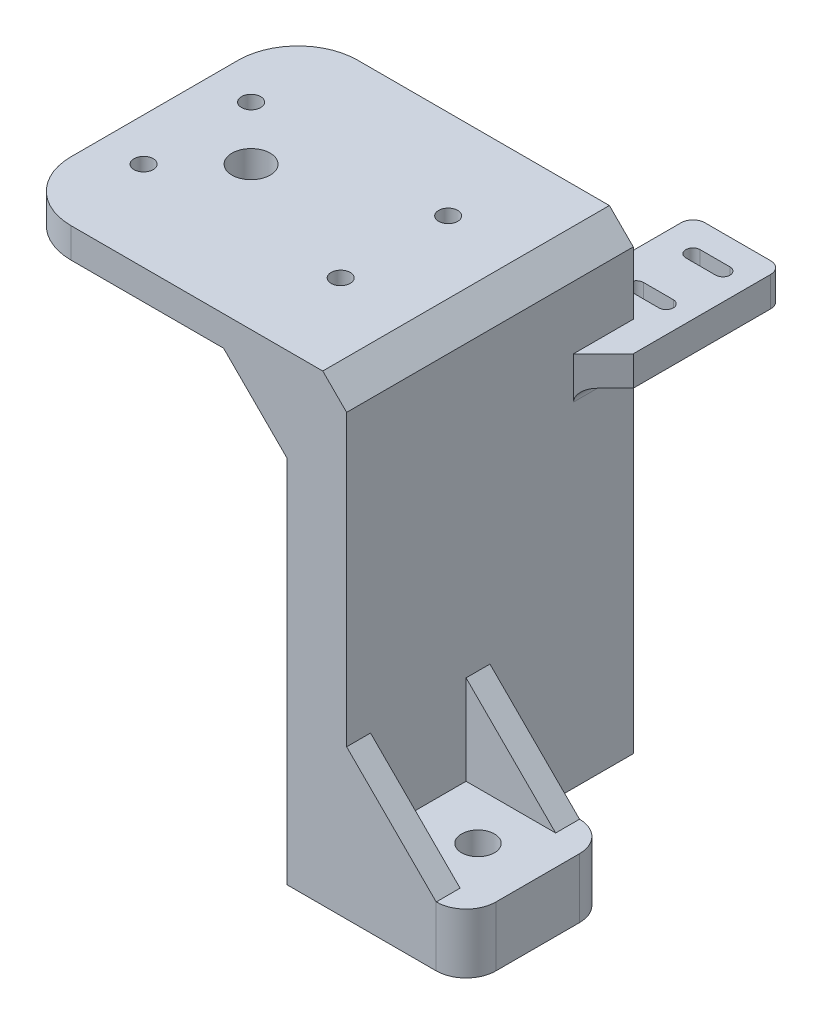
from build123d import *

# Parameters (mm, degrees)
SKETCH1_W                 = 56.15
SKETCH1_H                 = 48
BOSS_EXTRUDE1_DEPTH       = 5
SKETCH2_W                 = 10
SKETCH2_H                 = 48
BOSS_EXTRUDE2_DEPTH       = 72.5
SKETCH3_W                 = 24
SKETCH3_H                 = 10
BOSS_EXTRUDE3_DEPTH       = 20
SKETCH20_W                = 24
SKETCH20_H                = 10
BOSS_EXTRUDE5_DEPTH       = 20
FILLET1_R                 = 10
F_1_0MM_DOWEL_HOLE1_D     = 5.5
F_1_0MM_DOWEL_HOLE1_DEPTH = 10
FILLET2_R                 = 5
RIB1_REACH                = 103.39
SKETCH19_WALL_W           = 225.992615606
SKETCH19_WALL_H           = 4
M3_CLEARANCE_HOLE1_D      = 3.2
M3_CLEARANCE_HOLE1_DEPTH  = 5
M6_CLEARANCE_HOLE1_D      = 6.4
CHAMFER2_SIZE             = 4
SKETCH14_W                = 15
SKETCH14_H                = 5
BOSS_EXTRUDE4_DEPTH       = 20
CHAMFER3_SIZE             = 10
FILLET3_R                 = 2
M2_START                  = -14.5
M2_CLEARANCE_SLOT2_DEPTH  = 5
RIB5_REACH                = 103.39
SKETCH21_WALL_W           = 225.992615606
SKETCH21_WALL_H           = 4
BOSS_EXTRUDE6_DEPTH       = 4


# Read off the part's stored shape, not the designer's step: M2 Clearance Slot2
with BuildPart() as part:
    # Sketch1 → Boss-Extrude1 (new body)
    with BuildSketch(Plane(origin=(0, 0, 0), x_dir=(1, 0, 0), z_dir=(0, 1, 0))):
        with Locations((4.075, 0)):
            Rectangle(SKETCH1_W, SKETCH1_H)
    extrude(amount=BOSS_EXTRUDE1_DEPTH)

    # Sketch2 → Boss-Extrude2 (add)
    with BuildSketch(Plane.XZ):
        with Locations((27.15, 0)):
            Rectangle(SKETCH2_W, SKETCH2_H)
    extrude(amount=BOSS_EXTRUDE2_DEPTH)

    # Sketch3 → Boss-Extrude3 (add)
    with BuildSketch(Plane(origin=(32.15, 0, 0), x_dir=(0, 0, -1), z_dir=(1, 0, 0))):
        with Locations((-12, -67.5)):
            Rectangle(SKETCH3_W, SKETCH3_H)
    extrude(amount=BOSS_EXTRUDE3_DEPTH)

    # Sketch20 → Boss-Extrude5 (add)
    with BuildSketch(Plane.ZY.offset(-22.15)):
        with Locations((-12, -67.5)):
            Rectangle(SKETCH20_W, SKETCH20_H)
    extrude(amount=BOSS_EXTRUDE5_DEPTH)

    # Fillet1
    fillet1_edges = [part.edges().sort_by_distance(p)[0] for p in [
        (-24, 2.5, -24),
        (-24, 2.5, 24),
    ]]
    fillet(fillet1_edges, radius=FILLET1_R)

    # Ø1.0mm Dowel Hole1
    with Locations(Plane(origin=(0, -62.5, 0), x_dir=(1, 0, 0), z_dir=(0, 1, 0))):
        with Locations((42.15, -12), (12.15, 12)):
            Hole(F_1_0MM_DOWEL_HOLE1_D / 2, depth=F_1_0MM_DOWEL_HOLE1_DEPTH)

    # Fillet2
    fillet2_edges = [part.edges().sort_by_distance(p)[0] for p in [
        (52.15, -67.5, 24),
        (52.15, -67.5, 0),
        (2.15, -67.5, -24),
        (2.15, -67.5, 0),
    ]]
    fillet(fillet2_edges, radius=FILLET2_R)

    # Sketch19 wall → Rib1 (add, up to next)
    with BuildSketch(Plane(origin=(39.65, -55, 24), x_dir=(0.707106781187, -0.707106781187, 0), z_dir=(0.707106781187, 0.707106781187, 0)), mode=Mode.PRIVATE) as rib1_sk1:
        with Locations((0, 2)):
            Rectangle(SKETCH19_WALL_W, SKETCH19_WALL_H)
    rib1_tool1 = extrude(rib1_sk1.sketch, amount=-RIB1_REACH, mode=Mode.PRIVATE) - part.part
    rib1 = rib1_tool1.solids().sort_by_distance((39.65, -55, 24))[0]
    add(rib1)

    # M3 Clearance Hole1
    with Locations(Plane(origin=(0, 5, 0), x_dir=(1, 0, 0), z_dir=(0, 1, 0))):
        with Locations((-16.85, -9), (-16.85, 9), (16.15, 9), (16.15, -9)):
            Hole(M3_CLEARANCE_HOLE1_D / 2, depth=M3_CLEARANCE_HOLE1_DEPTH)

    # M6 Clearance Hole1 (through all)
    with Locations(Plane(origin=(0, 5, 0), x_dir=(1, 0, 0), z_dir=(0, 1, 0))):
        with Locations((-7.85, 0)):
            Hole(M6_CLEARANCE_HOLE1_D / 2)

    # Chamfer2
    chamfer2_edges = [part.edges().sort_by_distance(p)[0] for p in [
        (32.15, 5, 0),
    ]]
    chamfer(chamfer2_edges, length=CHAMFER2_SIZE)

    # Sketch14 → Boss-Extrude4 (add)
    with BuildSketch(Plane(origin=(0, 0, -24), x_dir=(-1, 0, 0), z_dir=(0, 0, -1))):
        with Locations((-29.65, -12)):
            Rectangle(SKETCH14_W, SKETCH14_H)
    extrude(amount=BOSS_EXTRUDE4_DEPTH)

    # Chamfer3
    # the kernel refuses this chamfer: 10 mm, written as the material it adds along each edge
    with BuildSketch(Plane(origin=(32.15, -9.5, -24), x_dir=(-0.027495876610586317, 0, 0.9996219169112968), z_dir=(0, -1, 0))) as chamfer3_piece_1_section:
        Polygon((CHAMFER3_SIZE * 0.999621916911, -CHAMFER3_SIZE * 0.0274958766106), (-CHAMFER3_SIZE * 0.0274958766106, -CHAMFER3_SIZE * 0.999621916911), (0, 0), align=None)
    chamfer3_piece_1 = extrude(amount=5, mode=Mode.PRIVATE)
    chamfer3_piece_1 = split(chamfer3_piece_1, bisect_by=Plane(origin=(37.15, -12, -20.111111111), z_dir=(-1, 0, 0)), keep=Keep.TOP, mode=Mode.PRIVATE)
    add(chamfer3_piece_1)

    # Fillet3
    fillet3_edges = [part.edges().sort_by_distance(p)[0] for p in [
        (27.15, -14.5, -24),
        (22.15, -12, -44),
        (37.15, -12, -44),
        (32.15, -14.5, -19),
    ]]
    fillet(fillet3_edges, radius=FILLET3_R)

    # M2 Clearance Slot2 outline → M2 Clearance Slot2 (cut)
    with BuildSketch(Plane(origin=(0, 0, 0), x_dir=(1, 0, 0), z_dir=(0, 1, 0)).offset(M2_START)):
        with BuildLine():
            Line((32.65, 39.7), (27.65, 39.7))
            ThreePointArc((27.65, 39.7), (26.45, 38.5), (27.65, 37.3))
            Line((27.65, 37.3), (32.65, 37.3))
            ThreePointArc((32.65, 37.3), (33.85, 38.5), (32.65, 39.7))
        make_face()
        with BuildLine():
            ThreePointArc((32.65, 27.8), (33.85, 29), (32.65, 30.2))
            Line((32.65, 30.2), (27.65, 30.2))
            ThreePointArc((27.65, 30.2), (26.45, 29), (27.65, 27.8))
            Line((27.65, 27.8), (32.65, 27.8))
        make_face()
    extrude(amount=M2_CLEARANCE_SLOT2_DEPTH, mode=Mode.SUBTRACT)

    # Mirror1: Rib1 across plane
    add(rib1.mirror(Plane(origin=(52.15, -62.5, 12), x_dir=(1, 0, 0), z_dir=(0, 0, -1))))

    # Sketch21 wall → Rib5 (add, up to next)
    with BuildSketch(Plane(origin=(14.65, -55, -24), x_dir=(-0.707106781187, -0.707106781187, 0), z_dir=(-0.707106781187, 0.707106781187, 0)), mode=Mode.PRIVATE) as rib5_sk1:
        with Locations((0, 2)):
            Rectangle(SKETCH21_WALL_W, SKETCH21_WALL_H)
    rib5_tool1 = extrude(rib5_sk1.sketch, amount=-RIB5_REACH, mode=Mode.PRIVATE) - part.part
    rib5 = rib5_tool1.solids().sort_by_distance((14.65, -55, -24))[0]
    add(rib5)

    # Mirror2: Rib5 across plane
    add(rib5.mirror(Plane(origin=(2.15, -62.5, -12), x_dir=(1, 0, 0), z_dir=(0, 0, 1))))

    # Sketch24 → Boss-Extrude6 (add)
    with BuildSketch(Plane.XY.offset(24)):
        Polygon((11.543398282, 0), (22.15, -10.606601718), (22.15, 0), align=None)
    boss_extrude6 = extrude(amount=-BOSS_EXTRUDE6_DEPTH)

    # Mirror3: Boss-Extrude6 across plane
    add(boss_extrude6.mirror(Plane.XY))


solid = part.part
